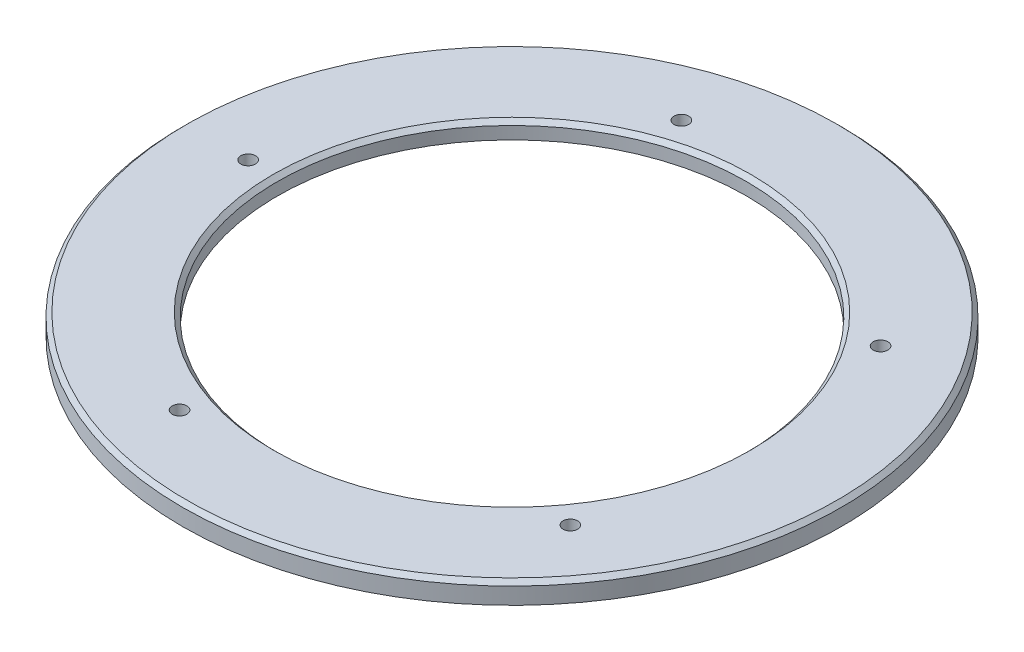
from build123d import *

# Parameters (mm, degrees)
SKETCH2_R          = 1.752085735
CUT_EXTRUDE2_DEPTH = 112.794454245
CHAMFER1_SIZE      = 1


with BuildPart() as part:
    # Sketch1 → Revolve1 (revolve)
    with BuildSketch(Plane.XY):
        Polygon((-70.25, 1), (-70.25, 0), (-79, 0), (-79, 5), (-56.25, 5), (-56.25, 1), align=None)
    revolve(axis=Axis((0, 0, 0), (0, 1, 0)))

    # Sketch2 → Cut-Extrude2 (cut, through all)
    with BuildSketch(Plane.XZ.offset(-1)):
        with Locations((-63.25, 0)):
            Circle(SKETCH2_R)
        with Locations((-19.545324894, 60.154324656)):
            Circle(SKETCH2_R)
        with Locations((51.170324894, 37.177417207)):
            Circle(SKETCH2_R)
        with Locations((51.170324894, -37.177417207)):
            Circle(SKETCH2_R)
        with Locations((-19.545324894, -60.154324656)):
            Circle(SKETCH2_R)
    extrude(amount=-CUT_EXTRUDE2_DEPTH, mode=Mode.SUBTRACT)

    # Chamfer1
    chamfer1_edges = [part.edges().sort_by_distance(p)[0] for p in [
        (79, 5, 0),
        (56.25, 5, 0),
    ]]
    chamfer(chamfer1_edges, length=CHAMFER1_SIZE)


solid = part.part
